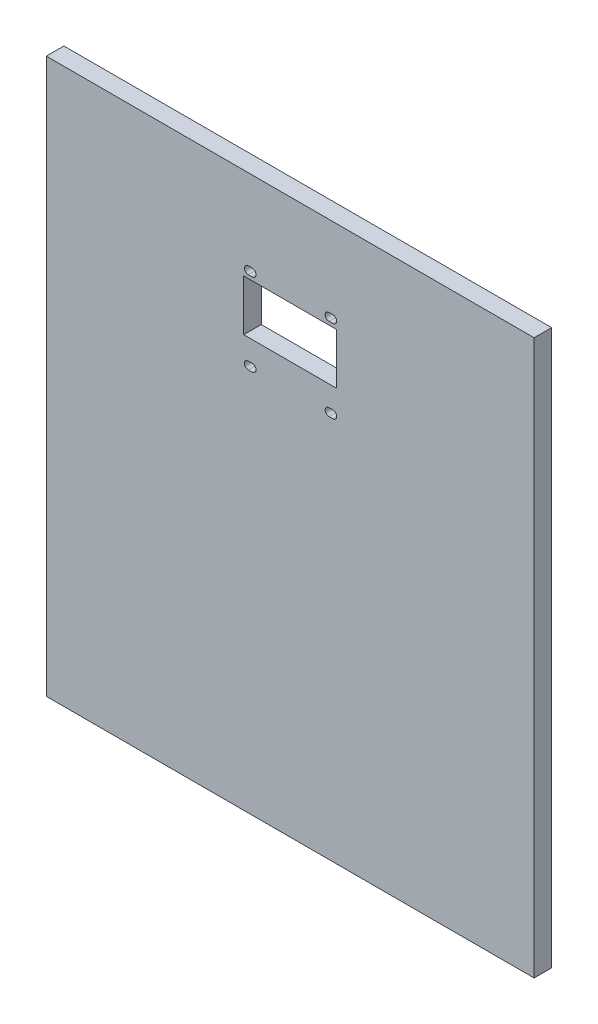
from build123d import *

# Parameters (mm, degrees)
SKETCH1_W           = 139
SKETCH1_H           = 158
SKETCH1_W_2         = 26.5
SKETCH1_H_2         = 14.5
BOSS_EXTRUDE1_DEPTH = 5


with BuildPart() as part:
    # Sketch1 → Boss-Extrude1 (new body)
    with BuildSketch(Plane.XY):
        with Locations((69.5, 79)):
            Rectangle(SKETCH1_W, SKETCH1_H)
        with Locations((69.5, 124.633208092)):
            Rectangle(SKETCH1_W_2, SKETCH1_H_2, mode=Mode.SUBTRACT)
        with BuildLine():
            Line((58.656950277, 135.033208092), (57.556950277, 135.033208092))
            ThreePointArc((57.556950277, 135.033208092), (56.456950277, 133.933208092), (57.556950277, 132.833208092))
            Line((57.556950277, 132.833208092), (58.656950277, 132.833208092))
            ThreePointArc((58.656950277, 132.833208092), (59.756950277, 133.933208092), (58.656950277, 135.033208092))
        make_face(mode=Mode.SUBTRACT)
        with BuildLine():
            Line((81.656950277, 135.033208092), (80.556950277, 135.033208092))
            ThreePointArc((80.556950277, 135.033208092), (79.456950277, 133.933208092), (80.556950277, 132.833208092))
            Line((80.556950277, 132.833208092), (81.656950277, 132.833208092))
            ThreePointArc((81.656950277, 132.833208092), (82.756950277, 133.933208092), (81.656950277, 135.033208092))
        make_face(mode=Mode.SUBTRACT)
        with BuildLine():
            Line((57.556950277, 109.333208092), (58.656950277, 109.333208092))
            ThreePointArc((58.656950277, 109.333208092), (59.756950277, 110.433208092), (58.656950277, 111.533208092))
            Line((58.656950277, 111.533208092), (57.556950277, 111.533208092))
            ThreePointArc((57.556950277, 111.533208092), (56.456950277, 110.433208092), (57.556950277, 109.333208092))
        make_face(mode=Mode.SUBTRACT)
        with BuildLine():
            Line((80.556950277, 109.333208092), (81.656950277, 109.333208092))
            ThreePointArc((81.656950277, 109.333208092), (82.756950277, 110.433208092), (81.656950277, 111.533208092))
            Line((81.656950277, 111.533208092), (80.556950277, 111.533208092))
            ThreePointArc((80.556950277, 111.533208092), (79.456950277, 110.433208092), (80.556950277, 109.333208092))
        make_face(mode=Mode.SUBTRACT)
    extrude(amount=BOSS_EXTRUDE1_DEPTH)


solid = part.part
